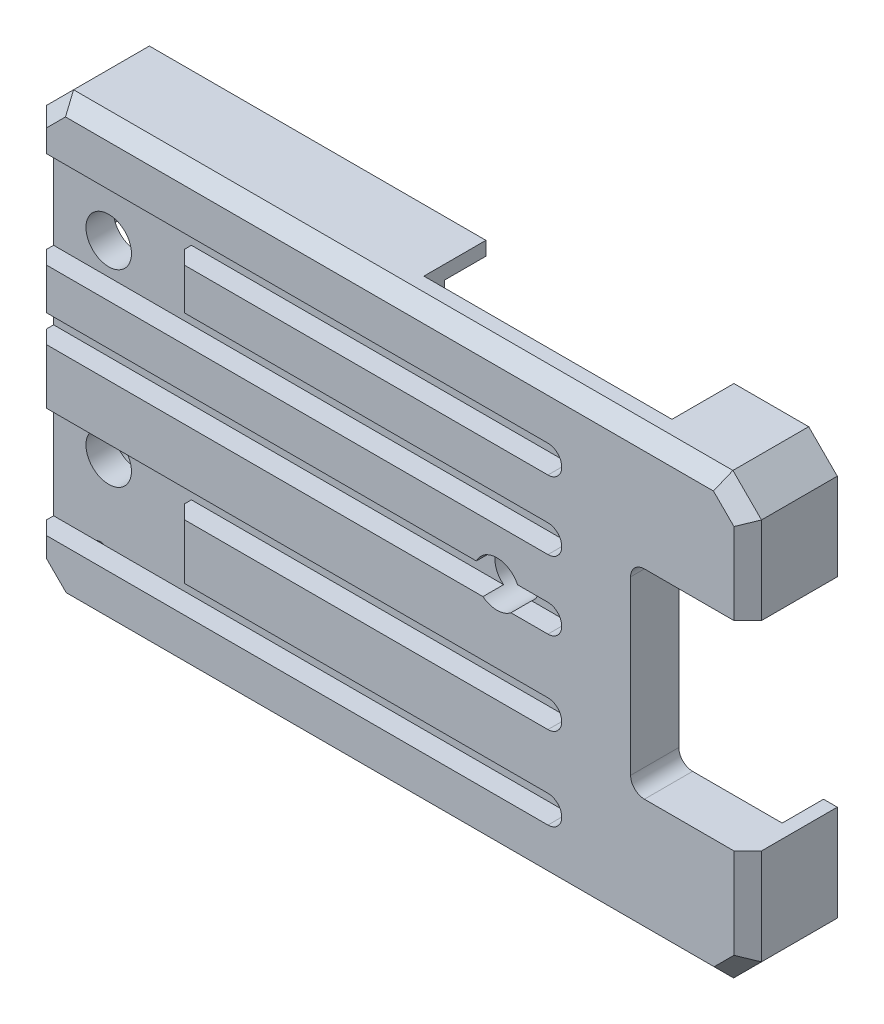
from build123d import *

# Parameters (mm, degrees)
EXTRUDE_2_DEPTH     = 6.5
CUT_EXTRUDE_1_DEPTH = 3
SKETCH_4_R          = 0.5
CUT_EXTRUDE_2_DEPTH = 5
SKETCH_5_W          = 10.662315839
SKETCH_5_H          = 14.474999285
CUT_EXTRUDE_3_DEPTH = 15
SKETCH_6_W          = 18
SKETCH_6_H          = 6.5630452
SKETCH_6_W_2        = 18.4
SKETCH_6_H_2        = 6.601696298
CUT_EXTRUDE_4_DEPTH = 4.5
SKETCH_8_W          = 13.913437684
SKETCH_8_H          = 10.074999285
CUT_EXTRUDE_5_DEPTH = 3.2
SKETCH_9_R          = 1.65
CUT_EXTRUDE_6_DEPTH = 23
CHAMFER_2_SIZE      = 1
FILLET_1_R          = 1
SKETCH_20_W         = 43.816957605
SKETCH_20_H         = 2
SKETCH_20_W_2       = 44.126249409
SKETCH_20_W_3       = 44.36192542
CUT_EXTRUDE_7_DEPTH = 1.5
FILLET_2_R          = 1
SKETCH_21_W         = 13.231285314
SKETCH_21_H         = 4.572576543
SKETCH_21_W_2       = 12.647552139
SKETCH_21_H_2       = 6.080553912
CUT_EXTRUDE_8_DEPTH = 1.5
CHAMFER_3_SIZE      = 1


with BuildPart() as part:
    # Эскиз2 → Бобышка-Вытянуть2 (new body)
    with BuildSketch(Plane.XY):
        Polygon((-1.450000048, 28.424999237), (-3.400000095, 26.475000381), (-3.400000095, -1.450000048), (-1.399999976, -3.450000048), (46.449998499, -3.450000048), (48.474998474, -1.424999952), (48.474998474, 26.350000381), (46.400001526, 28.424999237), align=None)
    extrude(amount=EXTRUDE_2_DEPTH)

    # Эскиз3 → Вырез-Вытянуть1 (cut)
    with BuildSketch(Plane(origin=(0, 0, 0), x_dir=(-1, 0, 0), z_dir=(0, 0, -1))):
        with BuildLine():
            Line((-45.474998474, -2.450000048), (-4.599999905, -2.450000048))
            ThreePointArc((-4.599999905, -2.450000048), (-3.185786342, -1.86421361), (-2.599999905, -0.450000048))
            Line((-2.599999905, -0.450000048), (-2.599999905, 0.549999952))
            ThreePointArc((-2.599999905, 0.549999952), (-2.014213467, 1.964213515), (-0.599999905, 2.549999952))
            Line((-0.599999905, 2.549999952), (0.400000095, 2.549999952))
            ThreePointArc((0.400000095, 2.549999952), (1.814213658, 3.13578639), (2.400000095, 4.549999952))
            Line((2.400000095, 4.549999952), (2.400000095, 20.424999237))
            ThreePointArc((2.400000095, 20.424999237), (1.814213658, 21.839212799), (0.400000095, 22.424999237))
            Line((0.400000095, 22.424999237), (-0.599999905, 22.424999237))
            ThreePointArc((-0.599999905, 22.424999237), (-2.014213467, 23.010785675), (-2.599999905, 24.424999237))
            Line((-2.599999905, 24.424999237), (-2.599999905, 25.424999237))
            ThreePointArc((-2.599999905, 25.424999237), (-3.185786342, 26.839212799), (-4.599999905, 27.424999237))
            Line((-4.599999905, 27.424999237), (-45.474998474, 27.424999237))
            ThreePointArc((-45.474998474, 27.424999237), (-46.889212036, 26.839212799), (-47.474998474, 25.424999237))
            Line((-47.474998474, 25.424999237), (-47.474998474, -0.450000048))
            ThreePointArc((-47.474998474, -0.450000048), (-46.889212036, -1.86421361), (-45.474998474, -2.450000048))
        make_face()
    extrude(amount=-CUT_EXTRUDE_1_DEPTH, mode=Mode.SUBTRACT)

    # Эскиз4 → Вырез-Вытянуть2 (cut)
    with BuildSketch(Plane(origin=(0, 0, 0), x_dir=(-1, 0, 0), z_dir=(0, 0, -1))):
        with Locations((0, 25)):
            Circle(SKETCH_4_R)
        Circle(SKETCH_4_R)
    extrude(amount=-CUT_EXTRUDE_2_DEPTH, mode=Mode.SUBTRACT)

    # Эскиз5 → Вырез-Вытянуть3 (cut)
    with BuildSketch(Plane(origin=(0, 0, 0), x_dir=(-1, 0, 0), z_dir=(0, 0, -1))):
        with Locations((-45.306156394, 12.787499595)):
            Rectangle(SKETCH_5_W, SKETCH_5_H)
    extrude(amount=-CUT_EXTRUDE_3_DEPTH, mode=Mode.SUBTRACT)

    # Эскиз6 → Вырез-Вытянуть4 (cut)
    with BuildSketch(Plane(origin=(0, 0, 0), x_dir=(-1, 0, 0), z_dir=(0, 0, -1))):
        with Locations((-31.974998474, 25.706521837)):
            Rectangle(SKETCH_6_W, SKETCH_6_H)
        with Locations((-31.874998474, -0.750848197)):
            Rectangle(SKETCH_6_W_2, SKETCH_6_H_2)
    extrude(amount=-CUT_EXTRUDE_4_DEPTH, mode=Mode.SUBTRACT)

    # Эскиз8 → Вырез-Вытянуть5 (cut)
    with BuildSketch(Plane(origin=(0, 0, 0), x_dir=(-1, 0, 0), z_dir=(0, 0, -1))):
        with Locations((-1.643281063, 12.587499595)):
            Rectangle(SKETCH_8_W, SKETCH_8_H)
    extrude(amount=-CUT_EXTRUDE_5_DEPTH, mode=Mode.SUBTRACT)

    # Эскиз9 → Вырез-Вытянуть6 (cut)
    with BuildSketch(Plane(origin=(0, 0, 3), x_dir=(-1, 0, 0), z_dir=(0, 0, -1))):
        with Locations((-30.274998474, 13.724999237)):
            Circle(SKETCH_9_R)
        with Locations((-0.599999905, 19.724999237)):
            Circle(SKETCH_9_R)
        with Locations(Location((-0.599999905, 6.049999952, 0), (0, 0, 65.380022671))):
            Circle(SKETCH_9_R)
    extrude(amount=-CUT_EXTRUDE_6_DEPTH, mode=Mode.SUBTRACT)

    # Фаска2
    chamfer_2_edges = [part.edges().sort_by_distance(p)[0] for p in [
        (-3.400000095, 12.512500167, 6.5),
        (-2.400000036, -2.450000048, 6.5),
        (22.524999262, -3.450000048, 6.5),
        (47.462498487, -2.4375, 6.5),
        (48.474998474, 2.0625, 6.5),
        (47.4375, 27.387499809, 6.5),
        (22.475000739, 28.424999237, 6.5),
        (48.474998474, 23.187499809, 6.5),
        (-2.425000072, 27.449999809, 6.5),
    ]]
    chamfer(chamfer_2_edges, length=CHAMFER_2_SIZE)

    # Скругление1
    fillet_1_edges = [part.edges().sort_by_distance(p)[0] for p in [
        (40.974998474, 22.424999237, 3.75),
        (22.974998474, 22.424999237, 3.75),
        (22.674998474, 2.549999952, 3.75),
        (41.074998474, 2.549999952, 3.75),
        (8.599999905, 17.624999237, 3.1),
        (8.599999905, 7.549999952, 3.1),
        (39.974998474, 5.549999952, 4.75),
        (39.974998474, 20.024999237, 4.75),
    ]]
    fillet(fillet_1_edges, radius=FILLET_1_R)

    # Эскиз20 → Вырез-Вытянуть7 (cut)
    with BuildSketch(Plane.XY.offset(6.5)):
        with Locations((13.066519672, 23.424999237)):
            Rectangle(SKETCH_20_W, SKETCH_20_H)
        with Locations((13.066519672, 13.424999237)):
            Rectangle(SKETCH_20_W, SKETCH_20_H)
        with Locations((12.91187377, 1.424999237)):
            Rectangle(SKETCH_20_W_2, SKETCH_20_H)
        with Locations((13.066519672, 7.424999237)):
            Rectangle(SKETCH_20_W, SKETCH_20_H)
        with Locations((12.794035764, 18.424999237)):
            Rectangle(SKETCH_20_W_3, SKETCH_20_H)
    extrude(amount=-CUT_EXTRUDE_7_DEPTH, mode=Mode.SUBTRACT)

    # Скругление2
    fillet_2_edges = [part.edges().sort_by_distance(p)[0] for p in [
        (34.974998474, 0.424999237, 5.75),
        (34.974998474, 6.424999237, 5.75),
        (34.974998474, 12.424999237, 5.75),
        (34.974998474, 17.424999237, 5.75),
        (34.974998474, 2.424999237, 5.75),
        (34.974998474, 8.424999237, 5.75),
        (34.974998474, 14.424999237, 5.75),
        (34.974998474, 19.424999237, 5.75),
        (34.974998474, 22.424999237, 5.75),
        (34.974998474, 24.424999237, 5.75),
    ]]
    fillet(fillet_2_edges, radius=FILLET_2_R - 0.0001)  # a hair under: the kernel refuses the full size

    # Эскиз21 → Вырез-Вытянуть8 (cut)
    with BuildSketch(Plane.XY.offset(6.5)):
        with Locations((-0.015642752, 20.906096965)):
            Rectangle(SKETCH_21_W, SKETCH_21_H)
        with Locations((0.276223836, 4.43995697)):
            Rectangle(SKETCH_21_W_2, SKETCH_21_H_2)
    extrude(amount=-CUT_EXTRUDE_8_DEPTH, mode=Mode.SUBTRACT)

    # Фаска3
    chamfer_3_edges = [part.edges().sort_by_distance(p)[0] for p in [
        (6.599999905, 20.924999237, 6.5),
        (6.599999905, 4.424999237, 6.5),
    ]]
    chamfer(chamfer_3_edges, length=CHAMFER_3_SIZE)


solid = part.part
